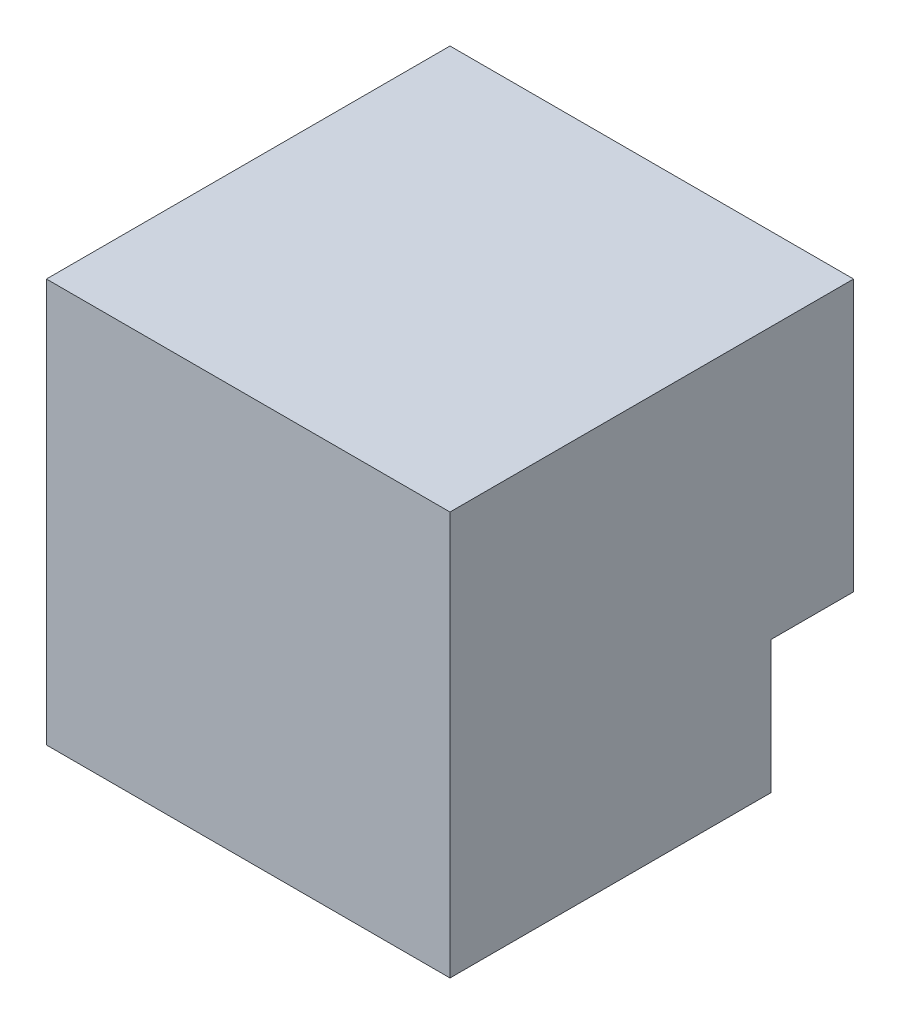
from build123d import *

# Parameters (mm, degrees)
SKETCH1_W           = 50.8
SKETCH1_H           = 50.8
BOSS_EXTRUDE1_DEPTH = 50.8
SKETCH5_W           = 50.8
SKETCH5_H           = 16.694974381
CUT_EXTRUDE1_DEPTH  = 10.414


with BuildPart() as part:
    # Sketch1 → Boss-Extrude1 (new body)
    with BuildSketch(Plane.XY):
        with Locations((25.4, 25.4)):
            Rectangle(SKETCH1_W, SKETCH1_H)
    extrude(amount=BOSS_EXTRUDE1_DEPTH)

    # Sketch5 → Cut-Extrude1 (cut)
    with BuildSketch(Plane(origin=(0, 0, 0), x_dir=(-1, 0, 0), z_dir=(0, 0, -1))):
        with Locations((-25.4, 8.347487191)):
            Rectangle(SKETCH5_W, SKETCH5_H)
    extrude(amount=-CUT_EXTRUDE1_DEPTH, mode=Mode.SUBTRACT)


solid = part.part
